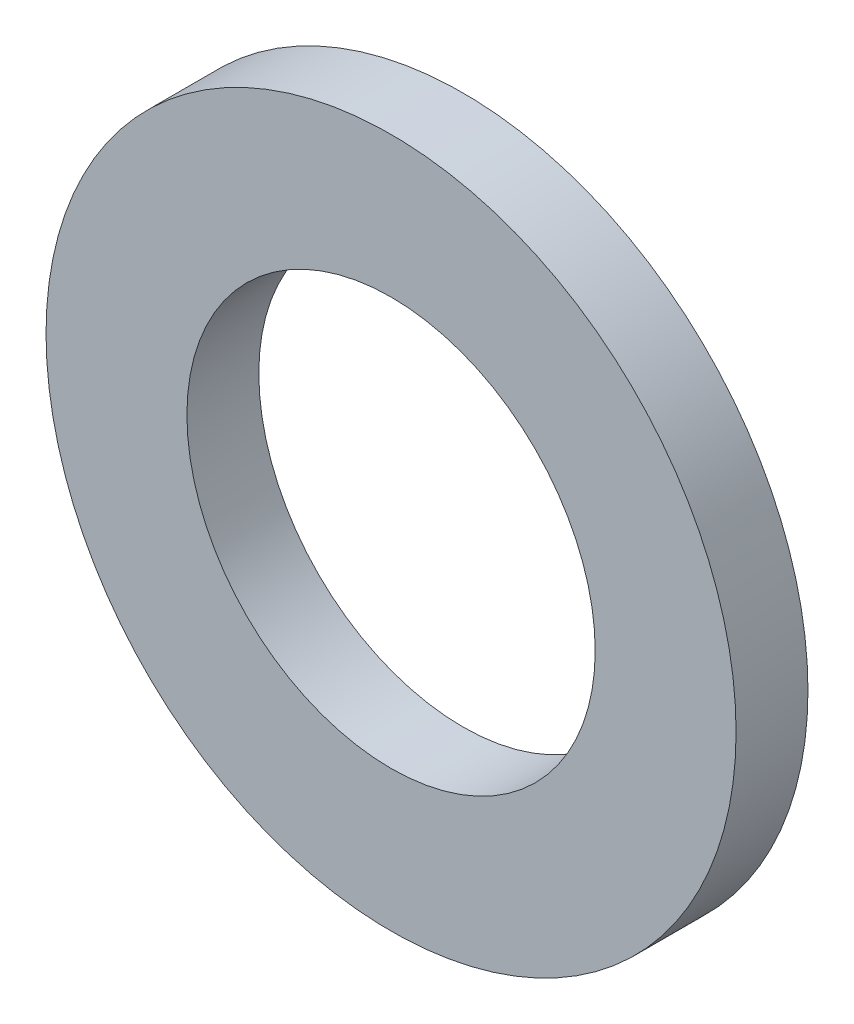
from build123d import *

# Parameters (mm, degrees)
SKETCH1_R           = 12
SKETCH1_R_2         = 7.1
BOSS_EXTRUDE1_DEPTH = 2.5


with BuildPart() as part:
    # Sketch1 → Boss-Extrude1 (new body)
    with BuildSketch(Plane.XY):
        Circle(SKETCH1_R)
        Circle(SKETCH1_R_2, mode=Mode.SUBTRACT)
    extrude(amount=BOSS_EXTRUDE1_DEPTH)


solid = part.part
